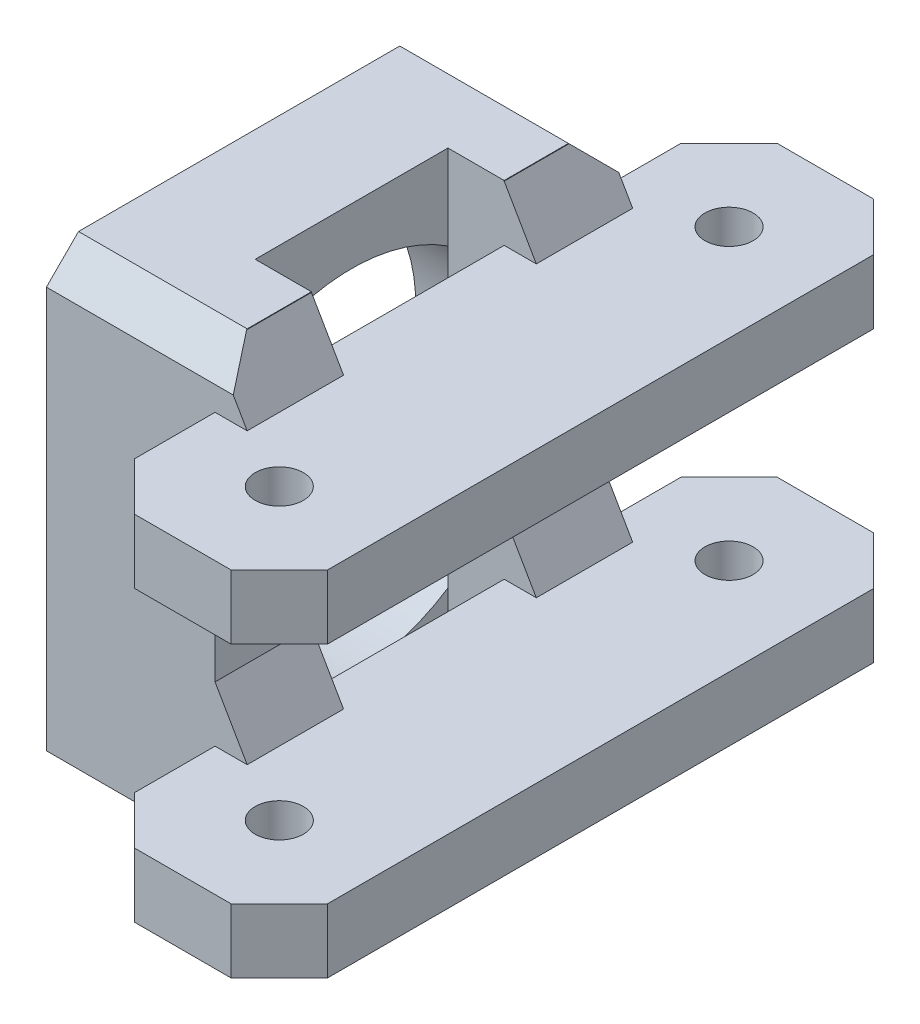
from build123d import *
from OCP.BRepFilletAPI import BRepFilletAPI_MakeChamfer

# Parameters (mm, degrees)
SKETCH1_R           = 1.5
BOSS_EXTRUDE1_DEPTH = 3
BOSS_EXTRUDE2_START = 22.5
SKETCH2_W           = 3.5
SKETCH2_H           = 6
BOSS_EXTRUDE2_DEPTH = 29
SKETCH4_R           = 1.5
BOSS_EXTRUDE5_DEPTH = 1
CHAMFER2_SIZE       = 2
CHAMFER2_SIZE2      = 3.464101615
SKETCH3_W           = 24
SKETCH3_H           = 29
SKETCH3_R           = 11
BOSS_EXTRUDE4_DEPTH = 7
CHAMFER3_SIZE       = 2
MIRROR1_START       = 18
MIRROR1_OUTLINE_R   = 1.5
MIRROR1_DEPTH       = 4
MIRROR1_START_2     = -12
MIRROR1_2_DEPTH     = 6
MIRROR1_START_3     = 6
MIRROR1_3_DEPTH     = 6
MIRROR1_START_4     = 25.102290732
MIRROR1_4_OUTLINE_W = 2
MIRROR1_4_OUTLINE_H = 18.102290732
MIRROR1_4_DEPTH     = 1.897709268
MIRROR1_START_5     = 7.071067812
MIRROR1_5_OUTLINE_W = 2
MIRROR1_5_OUTLINE_H = 2.897709268
MIRROR1_5_DEPTH     = 3.889087296


with BuildPart() as part:
    # Sketch1 → Boss-Extrude1 (new body)
    with BuildSketch(Plane(origin=(0, 0, 0), x_dir=(1, 0, 0), z_dir=(0, 1, 0))):
        Polygon((-6, 17), (-3, 20), (3, 20), (6, 17), (6, -17), (3, -20), (-3, -20), (-6, -17), align=None)
        with Locations(Location((0, 14, 0), (0, 0, 270))):
            Circle(SKETCH1_R, mode=Mode.SUBTRACT)
        with Locations(Location((0, -14, 0), (0, 0, 270))):
            Circle(SKETCH1_R, mode=Mode.SUBTRACT)
    extrude(amount=BOSS_EXTRUDE1_DEPTH)

    # Sketch2 → Boss-Extrude2 (add)
    with BuildSketch(Plane(origin=(0, 3, 0), x_dir=(1, 0, 0), z_dir=(0, 1, 0)).offset(BOSS_EXTRUDE2_START)):
        with Locations((-7.75, 9)):
            Rectangle(SKETCH2_W, SKETCH2_H)
        with Locations((-7.75, -9)):
            Rectangle(SKETCH2_W, SKETCH2_H)
    extrude(amount=-BOSS_EXTRUDE2_DEPTH)

    # Sketch4 → Boss-Extrude5 (add)
    with BuildSketch(Plane(origin=(0, 3, 0), x_dir=(1, 0, 0), z_dir=(0, 1, 0))):
        Polygon((-3, 20), (-6, 17), (-6, 12), (-6, 6), (-6, -6), (-6, -12), (-6, -17), (-3, -20), (3, -20), (6, -17), (6, 17), (3, 20), align=None)
        with Locations(Location((0, 14, 0), (0, 0, 270))):
            Circle(SKETCH4_R, mode=Mode.SUBTRACT)
        with Locations(Location((0, -14, 0), (0, 0, 270))):
            Circle(SKETCH4_R, mode=Mode.SUBTRACT)
    extrude(amount=BOSS_EXTRUDE5_DEPTH)

    # Chamfer2: one chamfer whose edges measure the first distance from different faces: ONE call of the kernel's chamfer builder (chamfer() names one face for all edges)
    chamfer2_edges_1 = [part.edges().sort_by_distance(p)[0] for p in [
        (-6, 0, -9),
        (-6, 0, 9),
    ]]
    chamfer2_side_1 = [part.faces().sort_by_distance(p)[0] for p in [
        (0, 0, 0),
    ]]
    chamfer2_edges_2 = [part.edges().sort_by_distance(p)[0] for p in [
        (-6, 4, -9),
        (-6, 4, 9),
    ]]
    chamfer2_side_2 = [part.faces().sort_by_distance(p)[0] for p in [
        (0, 4, 0),
    ]]
    chamfer2 = BRepFilletAPI_MakeChamfer(part.part.solid().wrapped)
    for e in chamfer2_edges_1:
        chamfer2.Add(CHAMFER2_SIZE, CHAMFER2_SIZE2, e.wrapped, chamfer2_side_1[0].wrapped)  # the first distance lies on this face
    for e in chamfer2_edges_2:
        chamfer2.Add(CHAMFER2_SIZE, CHAMFER2_SIZE2, e.wrapped, chamfer2_side_2[0].wrapped)  # the first distance lies on this face
    add(Compound.cast(chamfer2.Shape()), mode=Mode.REPLACE)

    # Sketch3 → Boss-Extrude4 (add)
    with BuildSketch(Plane.ZY.offset(9.5)):
        with Locations((0, 11)):
            Rectangle(SKETCH3_W, SKETCH3_H)
        with Locations(Location((0, 11, 0), (0, 0, 236.944268849))):
            Circle(SKETCH3_R, mode=Mode.SUBTRACT)
    extrude(amount=BOSS_EXTRUDE4_DEPTH)

    # Chamfer3
    chamfer3_edges = [part.edges().sort_by_distance(p)[0] for p in [
        (-11.25, 25.5, -12),
        (-11.25, -3.5, -12),
        (-11.25, -3.5, 12),
        (-11.25, 25.5, 12),
    ]]
    chamfer(chamfer3_edges, length=CHAMFER3_SIZE)

    # Mirror1: read off the stored shape, not the designer's step
    # Mirror1 outline → Mirror1 (add)
    with BuildSketch(Plane(origin=(0, 0, 0), x_dir=(1, 0, 0), z_dir=(0, 1, 0)).offset(MIRROR1_START)):
        Polygon((-6, 17), (-6, 6), (-6, -6), (-6, -17), (-3, -20), (3, -20), (6, -17), (6, 17), (3, 20), (-3, 20), align=None)
        with Locations((0, -14)):
            Circle(MIRROR1_OUTLINE_R, mode=Mode.SUBTRACT)
        with Locations((0, 14)):
            Circle(MIRROR1_OUTLINE_R, mode=Mode.SUBTRACT)
    extrude(amount=MIRROR1_DEPTH)

    # Mirror1 2 outline → Mirror1 2 (add)
    with BuildSketch(Plane.XY.offset(MIRROR1_START_2)):
        Polygon((-6, 14.535898385), (-4, 18), (-6, 18), align=None)
        Polygon((-4, 22), (-6, 25.464101615), (-6, 22), align=None)
    extrude(amount=MIRROR1_2_DEPTH)

    # Mirror1 3 outline → Mirror1 3 (add)
    with BuildSketch(Plane.XY.offset(MIRROR1_START_3)):
        Polygon((-2.535898385, 18), (-6, 18), (-6, 16), align=None)
        Polygon((-4, 22), (-6, 25.464101615), (-6, 22), align=None)
    extrude(amount=MIRROR1_3_DEPTH)

    # Mirror1 4 outline → Mirror1 4 (cut)
    with BuildSketch(Plane(origin=(0, 0, 0), x_dir=(1, 0, 0), z_dir=(0, 0.7071067811865466, 0.7071067811865486)).offset(MIRROR1_START_4)):
        with Locations((-5, 16.051145366)):
            Rectangle(MIRROR1_4_OUTLINE_W, MIRROR1_4_OUTLINE_H)
    extrude(amount=MIRROR1_4_DEPTH, mode=Mode.SUBTRACT)

    # Mirror1 5 outline → Mirror1 5 (cut)
    with BuildSketch(Plane(origin=(0, 0, 0), x_dir=(1, 0, 0), z_dir=(0, 0.7071067811865466, 0.7071067811865486)).offset(MIRROR1_START_5)):
        with Locations((-5, 26.551145366)):
            Rectangle(MIRROR1_5_OUTLINE_W, MIRROR1_5_OUTLINE_H)
    extrude(amount=MIRROR1_5_DEPTH, mode=Mode.SUBTRACT)


solid = part.part
